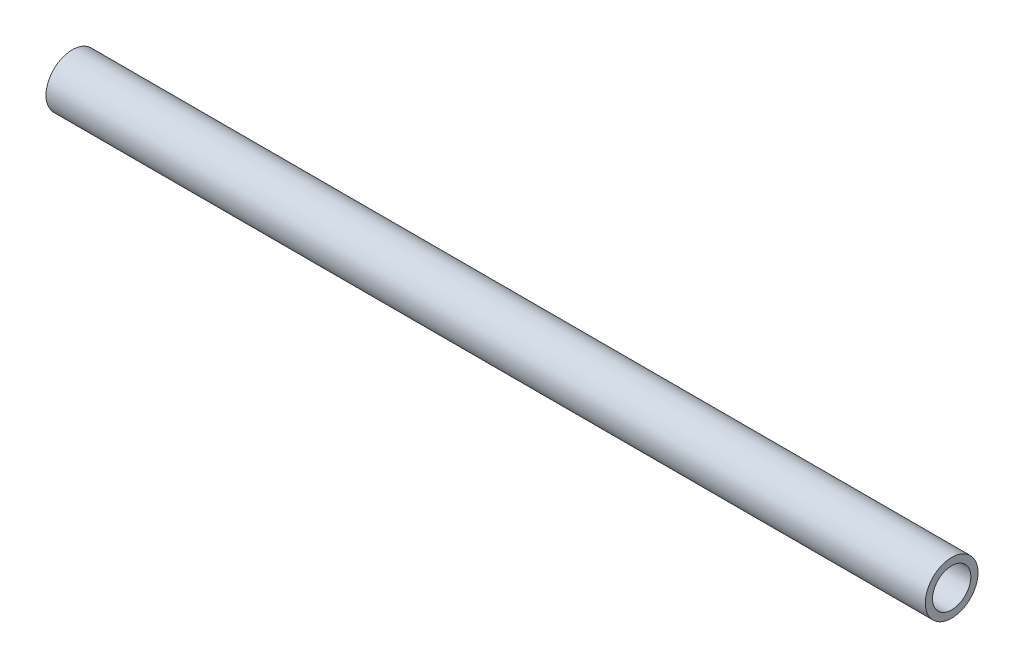
from build123d import *

# Parameters (mm, degrees)
SKETCH1_R           = 13.15
SKETCH1_R_2         = 9.55
BOSS_EXTRUDE1_DEPTH = 438.4


with BuildPart() as part:
    # Sketch1 → Boss-Extrude1 (new body)
    with BuildSketch(Plane(origin=(0, 0, 0), x_dir=(0, 0, -1), z_dir=(1, 0, 0))):
        Circle(SKETCH1_R)
        Circle(SKETCH1_R_2, mode=Mode.SUBTRACT)
    extrude(amount=BOSS_EXTRUDE1_DEPTH)


solid = part.part
